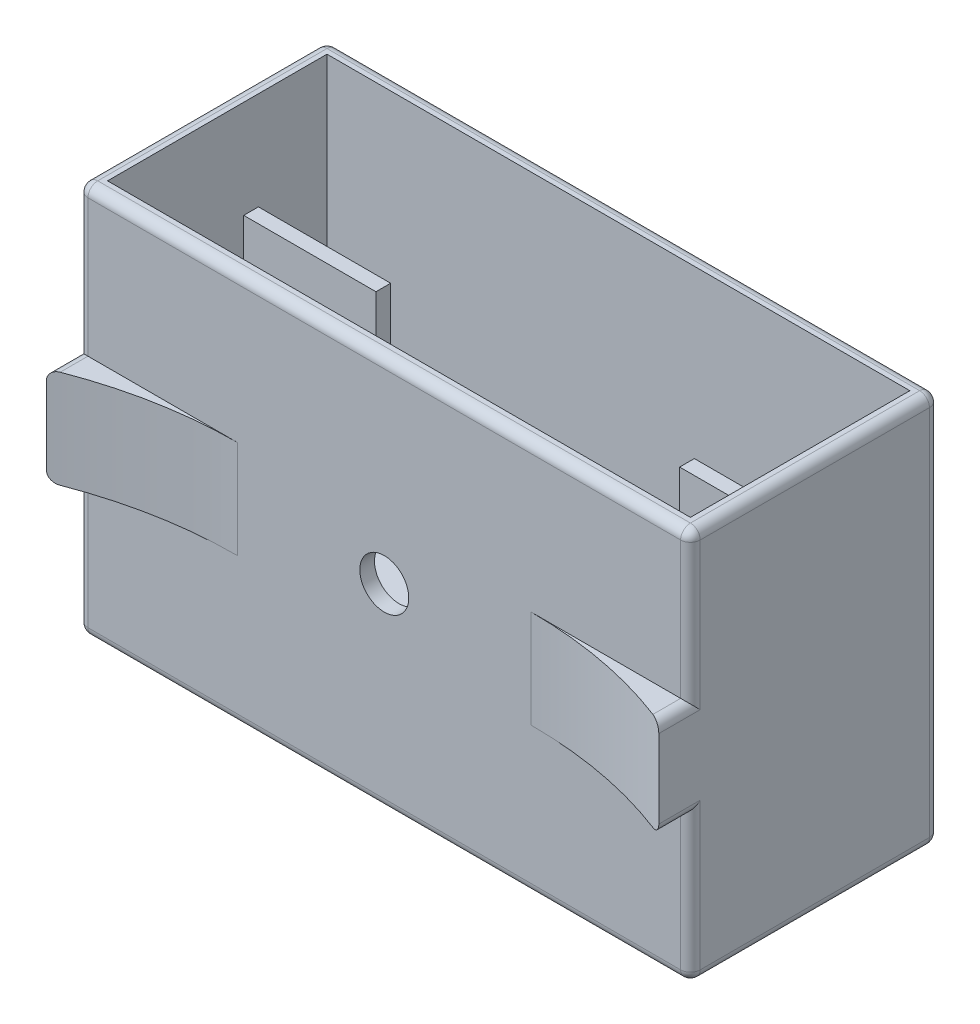
from build123d import *

# Parameters (mm, degrees)
BOSS_EXTRUDE1_DEPTH = 5
BOSS_EXTRUDE2_DEPTH = 20
SHELL1_START        = -18.5
SHELL1_OUTLINE_W    = 59.5
SHELL1_OUTLINE_H    = 22.4
SHELL1_DEPTH        = 38.5
SHELL1_START_2      = -3.5
SHELL1_2_DEPTH      = 7
SKETCH14_R          = 2.5
CUT_EXTRUDE1_DEPTH  = 1.5
SKETCH15_W          = 13.5
SKETCH15_H          = 1.5
SKETCH15_W_2        = 15
BOSS_EXTRUDE3_DEPTH = 10
FILLET21_R          = 1
CUT_EXTRUDE2_START  = -18.5
SKETCH16_R          = 2.5
CUT_EXTRUDE2_DEPTH  = 1.5


# Read off the part's stored shape, not the designer's step: Shell1
with BuildPart() as part:
    # Sketch13 → Boss-Extrude1 (new, symmetric)
    with BuildSketch(Plane(origin=(0, 0, 0), x_dir=(1, 0, 0), z_dir=(0, 1, 0))):
        with BuildLine():
            ThreePointArc((-31.25, 1.770695181), (-23.283883594, 4.184856634), (-15, 5))
            Line((-15, 5), (-31.25, 5))
            Line((-31.25, 5), (-31.25, 1.770695181))
        make_face()
        Polygon((-15, 5), (15, 5), (31.25, 5), (31.25, 30.4), (-31.25, 30.4), (-31.25, 5), align=None)
        with BuildLine():
            Line((31.25, 5), (15, 5))
            ThreePointArc((15, 5), (23.283883594, 4.184856634), (31.25, 1.770695181))
            Line((31.25, 1.770695181), (31.25, 5))
        make_face()
    extrude(amount=BOSS_EXTRUDE1_DEPTH, both=True)

    # Sketch13<12> → Boss-Extrude2 (add, symmetric)
    with BuildSketch(Plane(origin=(0, 0, 0), x_dir=(1, 0, 0), z_dir=(0, 1, 0))):
        Polygon((-15, 5), (15, 5), (31.25, 5), (31.25, 30.4), (-31.25, 30.4), (-31.25, 5), align=None)
    extrude(amount=BOSS_EXTRUDE2_DEPTH, both=True)

    # Shell1 outline → Shell1 (cut)
    with BuildSketch(Plane(origin=(0, 0, 0), x_dir=(1, 0, 0), z_dir=(0, 1, 0)).offset(SHELL1_START)):
        with Locations((0, 17.7)):
            Rectangle(SHELL1_OUTLINE_W, SHELL1_OUTLINE_H)
    extrude(amount=SHELL1_DEPTH, mode=Mode.SUBTRACT)

    # Shell1 2 outline → Shell1 2 (cut)
    with BuildSketch(Plane(origin=(0, 0, 0), x_dir=(1, 0, 0), z_dir=(0, 1, 0)).offset(SHELL1_START_2)):
        with BuildLine():
            Line((-29.75, 6.5), (-29.75, 3.954040816))
            ThreePointArc((-29.75, 3.954040816), (-22.484056523, 5.858838752), (-15, 6.5))
            Line((-15, 6.5), (-29.75, 6.5))
        make_face()
        with BuildLine():
            Line((29.75, 6.5), (15, 6.5))
            ThreePointArc((15, 6.5), (22.484056523, 5.858838752), (29.75, 3.954040816))
            Line((29.75, 3.954040816), (29.75, 6.5))
        make_face()
    extrude(amount=SHELL1_2_DEPTH, mode=Mode.SUBTRACT)

    # Sketch14 → Cut-Extrude1 (cut)
    with BuildSketch(Plane.XY.offset(-5)):
        with Locations(Location((0, 0, 0), (0, 0, 180))):
            Circle(SKETCH14_R)
    extrude(amount=-CUT_EXTRUDE1_DEPTH, mode=Mode.SUBTRACT)

    # Sketch15 → Boss-Extrude3 (add, symmetric)
    with BuildSketch(Plane(origin=(0, 0, 0), x_dir=(1, 0, 0), z_dir=(0, 1, 0))):
        with Locations((-23, 21.15)):
            Rectangle(SKETCH15_W, SKETCH15_H)
        with Locations((22.25, 21.15)):
            Rectangle(SKETCH15_W_2, SKETCH15_H)
    extrude(amount=BOSS_EXTRUDE3_DEPTH, both=True)

    # Fillet21
    fillet21_edges = [part.edges().sort_by_distance(p)[0] for p in [
        (-31.25, 0, -30.4),
        (31.25, 0, -30.4),
        (31.25, -5, -3.385347591),
        (31.25, 5, -3.385347591),
        (31.25, -12.5, -5),
        (-31.25, -20, -17.7),
        (-31.25, -12.5, -5),
        (0, -20, -5),
        (31.25, 12.5, -5),
        (31.25, 20, -17.7),
        (0, 20, -30.4),
        (-31.25, 12.5, -5),
        (-31.25, 20, -17.7),
        (0, 20, -5),
        (31.25, -20, -17.7),
        (0, -20, -30.4),
        (-31.25, 5, -3.385347591),
        (-31.25, -5, -3.385347591),
    ]]
    fillet(fillet21_edges, radius=FILLET21_R)

    # Sketch16 → Cut-Extrude2 (cut)
    with BuildSketch(Plane(origin=(0, 0, 0), x_dir=(1, 0, 0), z_dir=(0, 1, 0)).offset(CUT_EXTRUDE2_START)):
        with Locations(Location((0, 10, 0), (0, 0, 270))):
            Circle(SKETCH16_R)
    extrude(amount=-CUT_EXTRUDE2_DEPTH, mode=Mode.SUBTRACT)


solid = part.part
